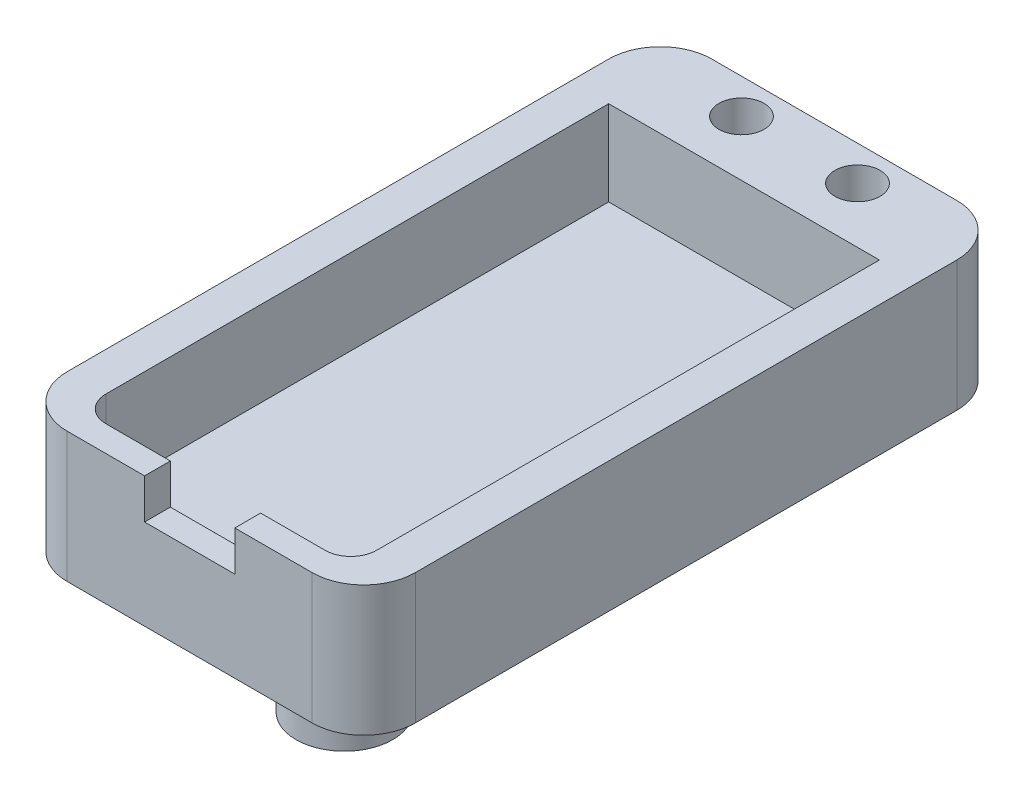
from build123d import *

# Parameters (mm, degrees)
SKETCH1_W           = 27
SKETCH1_H           = 41
BOSS_EXTRUDE1_DEPTH = 3.5
SKETCH2_W           = 3
SKETCH2_H           = 41
BOSS_EXTRUDE2_DEPTH = 7.5
SKETCH3_R           = 3.75
BOSS_EXTRUDE3_DEPTH = 10
SKETCH4_W           = 27
SKETCH4_H           = 11
BOSS_EXTRUDE4_DEPTH = 2
SKETCH5_W           = 27
SKETCH5_H           = 11
BOSS_EXTRUDE5_DEPTH = 2
CUT_EXTRUDE1_REACH  = 55.619
SKETCH6_W           = 7
SKETCH6_H           = 4
SKETCH7_W           = 27
SKETCH7_H           = 11
BOSS_EXTRUDE6_DEPTH = 5
SKETCH8_R           = 1.75
CUT_EXTRUDE2_DEPTH  = 59.940648113
SKETCH9_W           = 27
SKETCH9_H           = 50
CUT_EXTRUDE3_DEPTH  = 0.9
FILLET1_R           = 4
FILLET2_R           = 2


with BuildPart() as part:
    # Sketch1 → Boss-Extrude1 (new body)
    with BuildSketch(Plane(origin=(0, 0, 0), x_dir=(1, 0, 0), z_dir=(0, 1, 0))):
        with Locations((13.5, 20.5)):
            Rectangle(SKETCH1_W, SKETCH1_H)
    extrude(amount=BOSS_EXTRUDE1_DEPTH)

    # Sketch2 → Boss-Extrude2 (add)
    with BuildSketch(Plane(origin=(0, 3.5, 0), x_dir=(1, 0, 0), z_dir=(0, 1, 0))):
        with Locations((1.5, 20.5)):
            Rectangle(SKETCH2_W, SKETCH2_H)
        with Locations((25.5, 20.5)):
            Rectangle(SKETCH2_W, SKETCH2_H)
    extrude(amount=BOSS_EXTRUDE2_DEPTH)

    # Sketch3 → Boss-Extrude3 (add)
    with BuildSketch(Plane(origin=(0, 0, 0), x_dir=(-1, 0, 0), z_dir=(0, -1, 0))):
        with Locations((-13.5, 10)):
            Circle(SKETCH3_R)
    extrude(amount=BOSS_EXTRUDE3_DEPTH)

    # Sketch4 → Boss-Extrude4 (add)
    with BuildSketch(Plane(origin=(0, 0, -41), x_dir=(-1, 0, 0), z_dir=(0, 0, -1))):
        with Locations((-13.5, 5.5)):
            Rectangle(SKETCH4_W, SKETCH4_H)
    extrude(amount=BOSS_EXTRUDE4_DEPTH)

    # Sketch5 → Boss-Extrude5 (add)
    with BuildSketch(Plane.XY):
        with Locations((13.5, 5.5)):
            Rectangle(SKETCH5_W, SKETCH5_H)
    extrude(amount=BOSS_EXTRUDE5_DEPTH)

    # Sketch6 → Cut-Extrude1 (cut, up to next)
    with BuildSketch(Plane.XY.offset(2), mode=Mode.PRIVATE) as cut_extrude1_sk1:
        with Locations((13.5, 9)):
            Rectangle(SKETCH6_W, SKETCH6_H)
    cut_extrude1_tool1 = extrude(cut_extrude1_sk1.sketch, amount=-CUT_EXTRUDE1_REACH, mode=Mode.PRIVATE) & part.part
    add(cut_extrude1_tool1.solids().sort_by_distance((13.5, 9, 2))[0], mode=Mode.SUBTRACT)

    # Sketch7 → Boss-Extrude6 (add)
    with BuildSketch(Plane(origin=(0, 0, -43), x_dir=(-1, 0, 0), z_dir=(0, 0, -1))):
        with Locations((-13.5, 5.5)):
            Rectangle(SKETCH7_W, SKETCH7_H)
    extrude(amount=BOSS_EXTRUDE6_DEPTH)

    # Sketch8 → Cut-Extrude2 (cut, through all)
    with BuildSketch(Plane(origin=(0, 11, 0), x_dir=(1, 0, 0), z_dir=(0, 1, 0))):
        with Locations((18, 45.3)):
            Circle(SKETCH8_R)
        with Locations((9, 45.3)):
            Circle(SKETCH8_R)
    extrude(amount=-CUT_EXTRUDE2_DEPTH, mode=Mode.SUBTRACT)

    # Sketch9 → Cut-Extrude3 (cut)
    with BuildSketch(Plane(origin=(0, 11, 0), x_dir=(1, 0, 0), z_dir=(0, 1, 0))):
        with Locations((13.5, 23)):
            Rectangle(SKETCH9_W, SKETCH9_H)
    extrude(amount=-CUT_EXTRUDE3_DEPTH, mode=Mode.SUBTRACT)

    # Fillet1
    fillet1_edges = [part.edges().sort_by_distance(p)[0] for p in [
        (0, 5.05, -48),
        (27, 5.05, -48),
        (27, 5.05, 2),
        (0, 5.05, 2),
    ]]
    fillet(fillet1_edges, radius=FILLET1_R)

    # Fillet2
    fillet2_edges = [part.edges().sort_by_distance(p)[0] for p in [
        (24, 6.8, 0),
        (3, 6.8, 0),
    ]]
    fillet(fillet2_edges, radius=FILLET2_R)


solid = part.part
